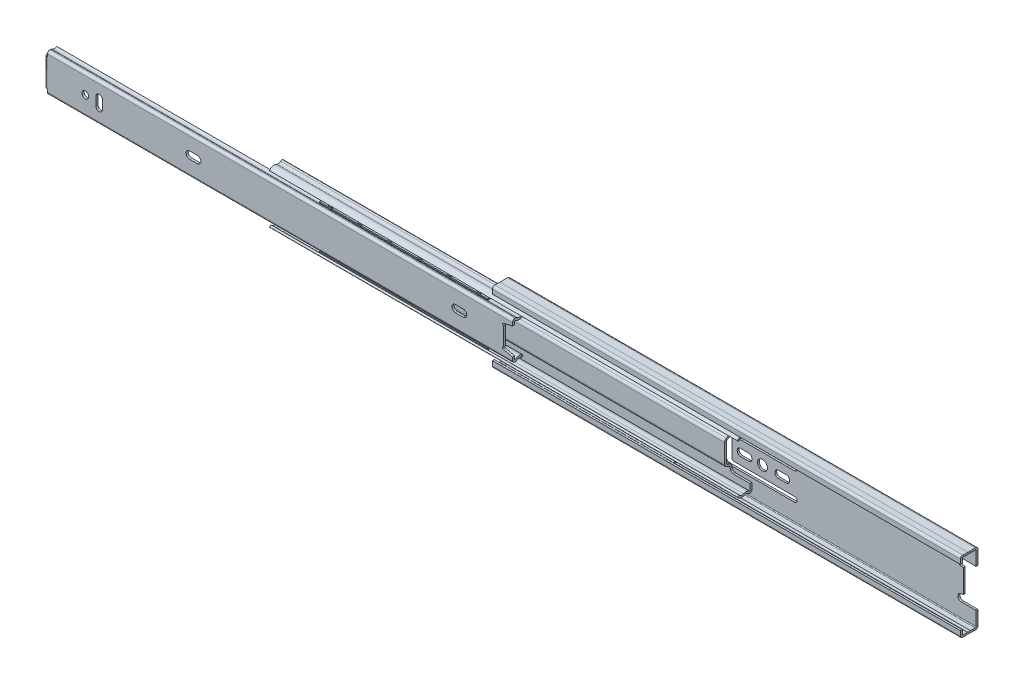
from build123d import *
from build123d.topology import SkipClean

# Parameters (mm, degrees)
EXTRUDE1_DEPTH      = 149.987
MIDDLE_MEMBER_DEPTH = 299.974
DRAWER_START        = -299.974
DRAWER_MEMBER_DEPTH = 299.974
SKETCH6_W           = 1.905
SKETCH6_H           = 12.147486483
CUT_EXTRUDE1_DEPTH  = 437.51899387
EXTRUDE4_DEPTH      = 8.89
CUT_EXTRUDE2_DEPTH  = 1.1938
CUT_EXTRUDE3_DEPTH  = 1.397
CUT_EXTRUDE4_DEPTH  = 437.388500312
CUT_EXTRUDE5_DEPTH  = 1.1938
CUT_EXTRUDE14_DEPTH = 1.1938
CUT_EXTRUDE6_DEPTH  = 1.1938
SKETCH24_R          = 2.1844
CUT_EXTRUDE13_DEPTH = 1.397
CUT_D_DEPTH         = 1.397
LPATTERN1_COUNT     = 6
LPATTERN1_PITCH     = 19.05
EXTRUDE7_DEPTH      = 6.35
EXTRUDE7_DEPTH_BACK = 101.6
SKETCH28_W          = 7.62
SKETCH28_H          = 0.762
LPATTERN2_COUNT     = 6
LPATTERN2_PITCH     = 19.05
EXTRUDE8_DEPTH      = 6.35
EXTRUDE8_DEPTH_BACK = 101.6
SKETCH30_W          = 5.08
SKETCH30_H          = 0.762
SKETCH34_W          = 46.355
SKETCH34_H          = 20.574000138
BOSS_EXTRUDE1_DEPTH = 1.1938


# Read off the part's stored shape, not the designer's step: Drawer Member
with BuildPart() as part:
    # Sketch1 → Extrude1 (new, symmetric)
    with BuildSketch(Plane(origin=(0, 0, 0), x_dir=(0, 0, -1), z_dir=(1, 0, 0))):
        with BuildLine():
            Line((-4.139279899, 22.8203125), (-0.743323143, 22.698920454))
            Line((-0.743323143, 22.698920454), (3.892452069, 22.8203125))
            ThreePointArc((3.892452069, 22.8203125), (5.124499805, 22.338098312), (5.6388, 21.119095664))
            Line((5.6388, 21.119095664), (5.6388, 0))
            Line((5.6388, 0), (4.445, 0))
            Line((4.445, 0), (4.445, 21.119095664))
            ThreePointArc((4.445, 21.119095664), (4.291477554, 21.482977052), (3.92370211, 21.626921585))
            Line((3.92370211, 21.626921585), (0.761857041, 21.544125758))
            ThreePointArc((0.761857041, 21.544125758), (-0.187154328, 21.71413397), (-1.131158407, 21.51822157))
            Line((-1.131158407, 21.51822157), (-4.181926298, 21.627274477))
            ThreePointArc((-4.181926298, 21.627274477), (-4.367367911, 21.55622161), (-4.445, 21.3734366))
            Line((-4.445, 21.3734366), (-4.445, 18.415))
            Line((-4.445, 18.415), (-5.6388, 18.415))
            Line((-5.6388, 18.415), (-5.6388, 21.3734366))
            ThreePointArc((-5.6388, 21.3734366), (-5.19629709, 22.415311161), (-4.139279899, 22.8203125))
        make_face()
    extrude(amount=EXTRUDE1_DEPTH, both=True)

    # Sketch8 → Cut-Extrude2 (cut)
    with BuildSketch(Plane.XY.offset(-4.445)):
        with BuildLine():
            Line((140.348533997, 7.645578895), (141.7828, 7.493000005))
            Line((141.7828, 7.493000005), (141.7828, 0))
            Line((141.7828, 0), (149.987, 0))
            Line((149.987, 0), (149.987, 12.204752384))
            Line((149.987, 12.204752384), (140.590356843, 12.204752384))
            ThreePointArc((140.590356843, 12.204752384), (138.307565723, 10.03983377), (140.348533997, 7.645578895))
        make_face()
    extrude(amount=-CUT_EXTRUDE2_DEPTH, mode=Mode.SUBTRACT)

    # Sketch13 → Cut-Extrude5 (cut)
    with BuildSketch(Plane.XY.offset(-4.445)):
        with BuildLine():
            Line((-81.598699917, 7.112000069), (-106.427199931, 7.112000069))
            ThreePointArc((-106.427199931, 7.112000069), (-106.966015347, 6.888815416), (-107.1892, 6.35))
            Line((-107.1892, 6.35), (-107.1892, 0))
            Line((-107.1892, 0), (-109.4752, 0))
            Line((-109.4752, 0), (-109.4752, 6.35))
            ThreePointArc((-109.4752, 6.35), (-109.698384653, 6.888815416), (-110.237200069, 7.112000069))
            Line((-110.237200069, 7.112000069), (-132.525699917, 7.112000069))
            ThreePointArc((-132.525699917, 7.112000069), (-134.113199917, 8.699500069), (-132.525699917, 10.287000069))
            Line((-132.525699917, 10.287000069), (-81.598699917, 10.287000069))
            ThreePointArc((-81.598699917, 10.287000069), (-80.011199917, 8.699500069), (-81.598699917, 7.112000069))
        make_face()
        with BuildLine():
            Line((-87.212099917, 2.286), (-92.165099917, 2.286))
            ThreePointArc((-92.165099917, 2.286), (-93.781546018, 1.616446102), (-94.451099917, 0))
            Line((-94.451099917, 0), (-84.926099917, 0))
            ThreePointArc((-84.926099917, 0), (-85.595653815, 1.616446102), (-87.212099917, 2.286))
        make_face()
        with BuildLine():
            Line((-126.264599917, 0), (-121.692599917, 0))
            ThreePointArc((-121.692599917, 0), (-123.978599917, 2.286), (-126.264599917, 0))
        make_face()
        with BuildLine():
            Line((-118.162000083, 0), (-111.811999917, 0))
            ThreePointArc((-111.811999917, 0), (-114.987, 3.175000083), (-118.162000083, 0))
        make_face()
        with BuildLine():
            Line((-104.674599917, 0), (-100.102599917, 0))
            ThreePointArc((-100.102599917, 0), (-102.388599917, 2.286), (-104.674599917, 0))
        make_face()
    extrude(amount=-CUT_EXTRUDE5_DEPTH, mode=Mode.SUBTRACT)

    # Sketch32 → Cut-Extrude14 (cut)
    with BuildSketch(Plane(origin=(0, 0, -5.6388), x_dir=(-1, 0, 0), z_dir=(0, 0, -1))):
        with BuildLine():
            Line((-30.4755, 0), (-20.9505, 0))
            ThreePointArc((-20.9505, 0), (-21.620053898, 1.616446102), (-23.2365, 2.286))
            Line((-23.2365, 2.286), (-28.1895, 2.286))
            ThreePointArc((-28.1895, 2.286), (-29.805946102, 1.616446102), (-30.4755, 0))
        make_face()
        with BuildLine():
            Line((-16.188, 0), (-9.838, 0))
            ThreePointArc((-9.838, 0), (-13.013, 3.175), (-16.188, 0))
        make_face()
        with BuildLine():
            Line((-6.3455, 0), (3.1795, 0))
            ThreePointArc((3.1795, 0), (2.509946102, 1.616446102), (0.8935, 2.286))
            Line((0.8935, 2.286), (-4.0595, 2.286))
            ThreePointArc((-4.0595, 2.286), (-5.675946102, 1.616446102), (-6.3455, 0))
        make_face()
        with BuildLine():
            Line((6.545, 0), (11.117, 0))
            Line((11.117, 0), (11.117, 8.763000069))
            ThreePointArc((11.117, 8.763000069), (10.670630735, 9.840630803), (9.593, 10.287000069))
            Line((9.593, 10.287000069), (-33.6505, 10.287000069))
            ThreePointArc((-33.6505, 10.287000069), (-35.238, 8.699500069), (-33.6505, 7.112000069))
            Line((-33.6505, 7.112000069), (5.021, 7.112000069))
            ThreePointArc((5.021, 7.112000069), (6.098630735, 6.665630803), (6.545, 5.588000069))
            Line((6.545, 5.588000069), (6.545, 0))
        make_face()
    extrude(amount=-CUT_EXTRUDE14_DEPTH, mode=Mode.SUBTRACT)

    # Sketch33 → Cut-Extrude6 (cut)
    with BuildSketch(Plane(origin=(83.609365602, 0.812450965, -5.6388), x_dir=(-1, 0, 0), z_dir=(0, 0, -1))):
        with BuildLine():
            Line((-42.866134398, -0.812450965), (-33.341134398, -0.812450965))
            ThreePointArc((-33.341134398, -0.812450965), (-34.010688296, 0.803995136), (-35.627134398, 1.473549035))
            Line((-35.627134398, 1.473549035), (-40.580134398, 1.473549035))
            ThreePointArc((-40.580134398, 1.473549035), (-42.1965805, 0.803995136), (-42.866134398, -0.812450965))
        make_face()
        with BuildLine():
            Line((-28.578634398, -0.812450965), (-22.228634398, -0.812450965))
            ThreePointArc((-22.228634398, -0.812450965), (-25.403634398, 2.362549035), (-28.578634398, -0.812450965))
        make_face()
        with BuildLine():
            Line((-18.736134398, -0.812450965), (-9.211134398, -0.812450965))
            ThreePointArc((-9.211134398, -0.812450965), (-9.880688296, 0.803995136), (-11.497134398, 1.473549035))
            Line((-11.497134398, 1.473549035), (-16.450134398, 1.473549035))
            ThreePointArc((-16.450134398, 1.473549035), (-18.0665805, 0.803995136), (-18.736134398, -0.812450965))
        make_face()
        with BuildLine():
            Line((-5.845634398, -0.812450965), (-1.273634398, -0.812450965))
            Line((-1.273634398, -0.812450965), (-1.273634398, 7.950549103))
            ThreePointArc((-1.273634398, 7.950549103), (-1.720003663, 9.028179838), (-2.797634398, 9.474549103))
            Line((-2.797634398, 9.474549103), (-46.041134398, 9.474549103))
            ThreePointArc((-46.041134398, 9.474549103), (-47.628634398, 7.887049103), (-46.041134398, 6.299549103))
            Line((-46.041134398, 6.299549103), (-7.369634398, 6.299549103))
            ThreePointArc((-7.369634398, 6.299549103), (-6.292003663, 5.853179838), (-5.845634398, 4.775549103))
            Line((-5.845634398, 4.775549103), (-5.845634398, -0.812450965))
        make_face()
    extrude(amount=-CUT_EXTRUDE6_DEPTH, mode=Mode.SUBTRACT)

    # Mirror3 3: part across plane


with BuildPart() as body_2:
    # Sketch2 → Middle Member (new body)
    with BuildSketch(Plane.ZY.offset(292.862)):
        with BuildLine():
            ThreePointArc((5.7404, 15.627692517), (3.735864231, 17.127444277), (1.241474216, 16.914283663))
            ThreePointArc((1.241474216, 16.914283663), (-0.188944013, 16.688900955), (-1.505642365, 17.291560999))
            ThreePointArc((-1.505642365, 17.291560999), (-2.813430342, 17.487614783), (-3.53059999, 16.376572852))
            Line((-3.53059999, 16.376572852), (-3.53059999, 9.521737984))
            ThreePointArc((-3.53059999, 9.521737984), (-3.220327109, 8.457239952), (-2.386691239, 7.726160915))
            Line((-2.386691239, 7.726160915), (-0.414564934, 6.806543316))
            ThreePointArc((-0.414564934, 6.806543316), (-0.093935732, 6.525359052), (0.0254, 6.115936705))
            Line((0.0254, 6.115936705), (0.0254, 0))
            Line((0.0254, 0), (1.2446, 0))
            Line((1.2446, 0), (1.2446, 6.115936705))
            ThreePointArc((1.2446, 6.115936705), (0.934327119, 7.180434735), (0.100691251, 7.91151377))
            Line((0.100691251, 7.91151377), (-1.871435054, 8.831131369))
            ThreePointArc((-1.871435054, 8.831131369), (-2.192064258, 9.112315634), (-2.31139999, 9.521737984))
            Line((-2.31139999, 9.521737984), (-2.31139999, 16.376572852))
            ThreePointArc((-2.31139999, 16.376572852), (-2.311399987, 16.376572856), (-2.311399982, 16.376572855))
            ThreePointArc((-2.311399982, 16.376572855), (-0.35482671, 15.481038557), (1.770730805, 15.815950333))
            ThreePointArc((1.770730805, 15.815950333), (3.400639083, 15.955235789), (4.710462095, 14.975253591))
            Line((4.710462095, 14.975253591), (5.7404, 15.627692517))
        make_face()
    extrude(amount=-MIDDLE_MEMBER_DEPTH)

    # Sketch12 → Cut-Extrude4 (cut, through all)
    with BuildSketch(Plane.XY.offset(1.2446)):
        with BuildLine():
            Line((7.112, 12.065), (-3.048, 12.065))
            ThreePointArc((-3.048, 12.065), (-4.844051224, 11.321051224), (-5.588, 9.525))
            Line((-5.588, 9.525), (-5.588, 0))
            Line((-5.588, 0), (7.112, 0))
            Line((7.112, 0), (7.112, 12.065))
        make_face()
    extrude(amount=-CUT_EXTRUDE4_DEPTH, mode=Mode.SUBTRACT)

    # Mirror3 2: body 2 across plane


with BuildPart() as body_3:
    # Drawer Member outline → Drawer Member (new body)
    with BuildSketch(Plane.ZY.offset(435.737).offset(DRAWER_START)):
        with BuildLine():
            Line((5.6642, 0), (7.0612, 0))
            Line((7.0612, 0), (7.0612, 10.623486483))
            ThreePointArc((7.0612, 10.623486483), (6.614830734, 11.701117218), (5.5372, 12.147486483))
            Line((5.5372, 12.147486483), (5.164341455, 12.147486483))
            ThreePointArc((5.164341455, 12.147486483), (4.67440708, 12.066587417), (4.236487447, 11.83247901))
            ThreePointArc((4.236487447, 11.83247901), (2.709144677, 11.334862777), (1.208194452, 11.907179363))
            Line((1.208194452, 11.907179363), (0.304054167, 10.842219578))
            ThreePointArc((0.304054167, 10.842219578), (2.674694689, 9.938287609), (5.087020295, 10.724235863))
            ThreePointArc((5.087020295, 10.724235863), (5.123513594, 10.743744895), (5.164341455, 10.750486483))
            Line((5.164341455, 10.750486483), (5.5372, 10.750486483))
            ThreePointArc((5.5372, 10.750486483), (5.627002561, 10.713289044), (5.6642, 10.623486483))
            Line((5.6642, 10.623486483), (5.6642, 0))
        make_face()
    extrude(amount=DRAWER_MEMBER_DEPTH)

    # Sketch6 → Cut-Extrude1 (cut, through all)
    with BuildSketch(Plane.XY.offset(7.0612)):
        with Locations((-434.7845, 6.073743242)):
            Rectangle(SKETCH6_W, SKETCH6_H)
    extrude(amount=-CUT_EXTRUDE1_DEPTH, mode=Mode.SUBTRACT)

    # Sketch7 → Extrude4 (add)
    with BuildSketch(Plane.XZ):
        with BuildLine():
            Line((-433.832, 7.0612), (-434.086, 7.0612))
            ThreePointArc((-434.086, 7.0612), (-435.253433296, 6.577633296), (-435.737, 5.4102))
            Line((-435.737, 5.4102), (-435.737, 0.304054167))
            Line((-435.737, 0.304054167), (-434.34, 0.304054167))
            Line((-434.34, 0.304054167), (-434.34, 5.4102))
            ThreePointArc((-434.34, 5.4102), (-434.265605122, 5.589805122), (-434.086, 5.6642))
            Line((-434.086, 5.6642), (-433.832, 5.6642))
            Line((-433.832, 5.6642), (-433.832, 7.0612))
        make_face()
    extrude(amount=-EXTRUDE4_DEPTH)

    # Sketch11 → Cut-Extrude3 (cut)
    with BuildSketch(Plane.XY.offset(7.0612)):
        with BuildLine():
            Line((-141.477951398, 5.967847879), (-141.478, 0))
            Line((-141.478, 0), (-135.763, 0))
            Line((-135.763, 0), (-135.763, 8.589285844))
            Line((-135.763, 8.589285844), (-141.622326457, 7.221216084))
            ThreePointArc((-141.622326457, 7.221216084), (-142.108774848, 6.530182899), (-141.477951398, 5.967847879))
        make_face()
    extrude(amount=-CUT_EXTRUDE3_DEPTH, mode=Mode.SUBTRACT)

    # Sketch24 → Cut-Extrude13 (cut)
    with BuildSketch(Plane.XY.offset(7.0612)):
        with Locations((-409.575, 0)):
            Circle(SKETCH24_R)
        with BuildLine():
            Line((-402.8694, 2.6416), (-402.8694, 0))
            Line((-402.8694, 0), (-398.5006, 0))
            Line((-398.5006, 0), (-398.5006, 2.6416))
            ThreePointArc((-398.5006, 2.6416), (-400.685, 4.826), (-402.8694, 2.6416))
        make_face()
        with BuildLine():
            Line((-344.9955, 0), (-335.4705, 0))
            ThreePointArc((-335.4705, 0), (-336.140053898, 1.616446102), (-337.7565, 2.286))
            Line((-337.7565, 2.286), (-342.7095, 2.286))
            ThreePointArc((-342.7095, 2.286), (-344.325946102, 1.616446102), (-344.9955, 0))
        make_face()
    extrude(amount=-CUT_EXTRUDE13_DEPTH, mode=Mode.SUBTRACT)

    # Sketch25 → Cut D (cut)
    with BuildSketch(Plane.XY.offset(7.0612)):
        with BuildLine():
            Line((-165.0365, 0), (-174.5615, 0))
            ThreePointArc((-174.5615, 0), (-173.891946102, 1.616446102), (-172.2755, 2.286))
            Line((-172.2755, 2.286), (-167.3225, 2.286))
            ThreePointArc((-167.3225, 2.286), (-165.706053898, 1.616446102), (-165.0365, 0))
        make_face()
    extrude(amount=-CUT_D_DEPTH, mode=Mode.SUBTRACT)

    # Mirror3: body 3 across plane


with BuildPart() as body_4:
    # Sketch27 → Revolve1 (revolve)
    with BuildSketch(Plane.ZY.offset(137.287)):
        with BuildLine():
            Line((0.1524, 21.683172421), (0.1524, 16.665571078))
            ThreePointArc((0.1524, 16.665571078), (2.661200671, 19.174371749), (0.1524, 21.683172421))
        make_face()
    revolve(axis=Axis((-137.287, 23.635004298, 0.1524), (0, -1, 0)))


with BuildPart() as lpattern1_1:
    # LPattern1: pattern copy
    add(body_4.part.moved(Location(Vector(1, 0, 0) * (1 * LPATTERN1_PITCH))))


with BuildPart() as lpattern1_2:
    # LPattern1: pattern copy
    add(body_4.part.moved(Location(Vector(1, 0, 0) * (2 * LPATTERN1_PITCH))))


with BuildPart() as lpattern1_3:
    # LPattern1: pattern copy
    add(body_4.part.moved(Location(Vector(1, 0, 0) * (3 * LPATTERN1_PITCH))))


with BuildPart() as lpattern1_4:
    # LPattern1: pattern copy
    add(body_4.part.moved(Location(Vector(1, 0, 0) * (4 * LPATTERN1_PITCH))))


with BuildPart() as lpattern1_5:
    # LPattern1: pattern copy
    add(body_4.part.moved(Location(Vector(1, 0, 0) * (5 * LPATTERN1_PITCH))))


with BuildPart() as body_4_1:
    add(body_4.part)

    add(lpattern1_1.part)  # Extrude7 merges LPattern1_1

    add(lpattern1_2.part)  # Extrude7 merges LPattern1_2

    add(lpattern1_3.part)  # Extrude7 merges LPattern1_3

    add(lpattern1_4.part)  # Extrude7 merges LPattern1_4

    add(lpattern1_5.part)  # Extrude7 merges LPattern1_5
    # Sketch28 → Extrude7 (add, two sides: drawn at the far end of the back side and taken through both)
    with BuildSketch(Plane.ZY.offset(137.287).offset(-EXTRUDE7_DEPTH_BACK)):
        with Locations((0.1524, 19.174371749)):
            Rectangle(SKETCH28_W, SKETCH28_H)
    extrude(amount=EXTRUDE7_DEPTH + EXTRUDE7_DEPTH_BACK)


with BuildPart() as body_5:
    # Sketch29 → Revolve2 (revolve)
    with BuildSketch(Plane.ZY.offset(254.762)):
        with BuildLine():
            Line((2.7686, 16.043834368), (2.7686, 11.446434358))
            ThreePointArc((2.7686, 11.446434358), (5.067300005, 13.745134363), (2.7686, 16.043834368))
        make_face()
    revolve(axis=Axis((-254.762, 16.680143034, 2.7686), (0, -1, 0)))


with BuildPart() as lpattern2_1:
    # LPattern2: pattern copy
    add(body_5.part.moved(Location(Vector(1, 0, 0) * (1 * LPATTERN2_PITCH))))


with BuildPart() as lpattern2_2:
    # LPattern2: pattern copy
    add(body_5.part.moved(Location(Vector(1, 0, 0) * (2 * LPATTERN2_PITCH))))


with BuildPart() as lpattern2_3:
    # LPattern2: pattern copy
    add(body_5.part.moved(Location(Vector(1, 0, 0) * (3 * LPATTERN2_PITCH))))


with BuildPart() as lpattern2_4:
    # LPattern2: pattern copy
    add(body_5.part.moved(Location(Vector(1, 0, 0) * (4 * LPATTERN2_PITCH))))


with BuildPart() as lpattern2_5:
    # LPattern2: pattern copy
    add(body_5.part.moved(Location(Vector(1, 0, 0) * (5 * LPATTERN2_PITCH))))


with BuildPart() as body_5_1:
    add(body_5.part)

    add(lpattern2_1.part)  # Extrude8 merges LPattern2_1

    add(lpattern2_2.part)  # Extrude8 merges LPattern2_2

    add(lpattern2_3.part)  # Extrude8 merges LPattern2_3

    add(lpattern2_4.part)  # Extrude8 merges LPattern2_4

    add(lpattern2_5.part)  # Extrude8 merges LPattern2_5
    # Sketch30 → Extrude8 (add, two sides: drawn at the far end of the back side and taken through both)
    with BuildSketch(Plane.ZY.offset(254.762).offset(-EXTRUDE8_DEPTH_BACK)):
        with Locations((2.7686, 13.745134363)):
            Rectangle(SKETCH30_W, SKETCH30_H)
    extrude(amount=EXTRUDE8_DEPTH + EXTRUDE8_DEPTH_BACK)


with BuildPart() as body_3_1:
    with SkipClean():  # the faces are left unmerged after this step: merging them gives an invalid solid
        add(body_3.part)
        add(body_3.part.mirror(Plane.ZX))


with BuildPart() as body_2_1:
    add(body_2.part)
    add(body_2.part.mirror(Plane.ZX))


with BuildPart() as part_1:
    with SkipClean():  # the faces are left unmerged after this step: merging them gives an invalid solid
        add(part.part)
        add(part.part.mirror(Plane.ZX))

    # Sketch34 → Boss-Extrude1 (add)
    with SkipClean():  # the faces are left unmerged after this step: merging them gives an invalid solid
        with BuildSketch(Plane.XY.offset(-4.445)):
            with Locations((108.0605, 0)):
                Rectangle(SKETCH34_W, SKETCH34_H)
        extrude(amount=-BOSS_EXTRUDE1_DEPTH)


with BuildPart() as body_6:
    # Mirror5: mirrored copy
    add(body_5_1.part.mirror(Plane.ZX))


with BuildPart() as body_7:
    # Mirror5 2: mirrored copy
    add(body_4_1.part.mirror(Plane.ZX))


solid = Compound([body_4_1.part, body_5_1.part, body_3_1.part, body_2_1.part, part_1.part, body_6.part, body_7.part])
